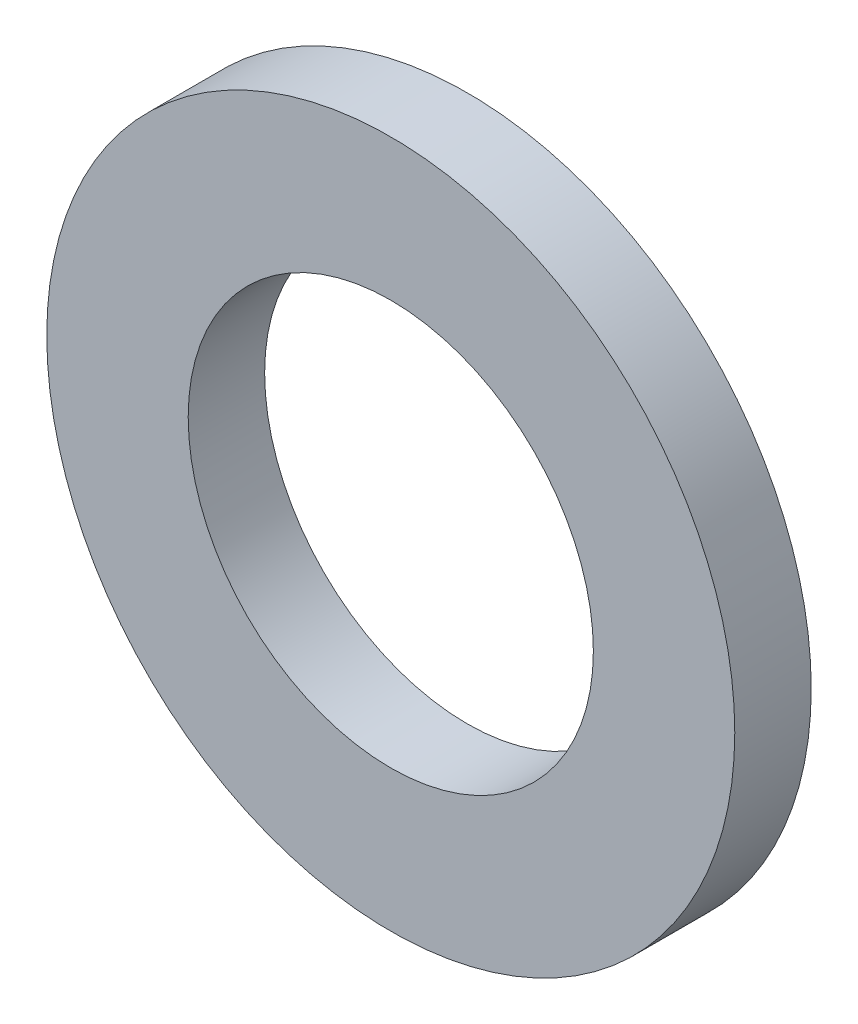
from build123d import *

# Parameters (mm, degrees)
SKETCH1_R           = 4.5
SKETCH1_R_2         = 2.65
BOSS_EXTRUDE1_DEPTH = 1


with BuildPart() as part:
    # Sketch1 → Boss-Extrude1 (new body)
    with BuildSketch(Plane.XY):
        Circle(SKETCH1_R)
        Circle(SKETCH1_R_2, mode=Mode.SUBTRACT)
    extrude(amount=BOSS_EXTRUDE1_DEPTH)


solid = part.part
